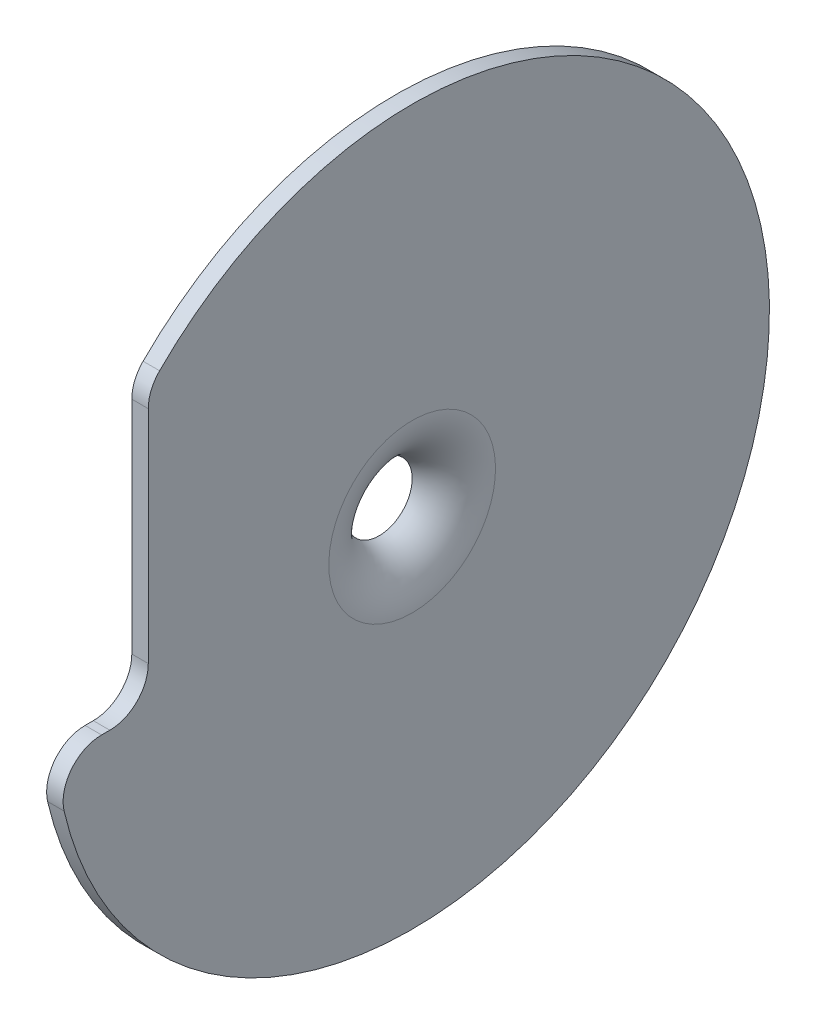
from build123d import *

# Parameters (mm, degrees)
SKETCH1_W           = 52
SKETCH1_H           = 38
BULK_EXTRUDE_DEPTH  = 3
FILLET1_R           = 7
SKETCH2_R           = 31.5
MOTOR_SUPPORT_DEPTH = 3
SKETCH3_R           = 6
WIRE_PASSTHRU_DEPTH = 143.168954603
FILLET2_R           = 10


with BuildPart() as part:
    # Sketch1 → BULK EXTRUDE (new body)
    # profile 1 of 3: a face of its own
    with BuildSketch(Plane.ZY.offset(19)):
        with BuildLine():
            Line((-2, -62.201941274), (-2, -24.5))
            Line((-2, -24.5), (-2, 25.456486729))
            ThreePointArc((-2, 25.456486729), (-115, -18.372727273), (-2, -62.201941274))
        make_face()
        with Locations((-57, 0)):
            Rectangle(SKETCH1_W, SKETCH1_H, mode=Mode.SUBTRACT)
    # profile 2 of 3: a face of its own
    with BuildSketch(Plane.ZY.offset(19)):
        with Locations((-57, 0)):
            Rectangle(SKETCH1_W, SKETCH1_H)
    # profile 3 of 3: a face of its own
    with BuildSketch(Plane.ZY.offset(19)):
        with BuildLine():
            Line((14.71055964, -24.5), (-2, -24.5))
            Line((-2, -24.5), (-2, -62.201941274))
            ThreePointArc((-2, -62.201941274), (9.424545918, -44.711355605), (14.71055964, -24.5))
        make_face()
    extrude(amount=BULK_EXTRUDE_DEPTH)

    # Fillet1
    fillet1_edges = [part.edges().sort_by_distance(p)[0] for p in [
        (-20.5, -24.5, -2),
        (-20.5, -24.5, 14.71055964),
        (-20.5, 25.456486729, -2),
    ]]
    fillet(fillet1_edges, radius=FILLET1_R)

    # Sketch2 → MOTOR SUPPORT (add)
    with BuildSketch(Plane.ZY.offset(22)):
        with Locations(Location((-50, -18.372727273, 0), (0, 0, 270))):
            Circle(SKETCH2_R)
    extrude(amount=MOTOR_SUPPORT_DEPTH)

    # Sketch3 → WIRE PASSTHRU (cut, through all)
    with BuildSketch(Plane.ZY.offset(25)):
        with Locations(Location((-50, -18.372727273, 0), (0, 0, 270))):
            Circle(SKETCH3_R)
    extrude(amount=-WIRE_PASSTHRU_DEPTH, mode=Mode.SUBTRACT)

    # Fillet2
    # the kernel refuses this fillet: 10 mm, written as the material it takes off along each edge
    with BuildSketch(Plane(origin=(-19, -18.372727273, -50), x_dir=(0, -1, 0), z_dir=(0, 0, -1))) as fillet2_piece_1:
        with BuildLine():
            CenterArc((15.16515139, 10), FILLET2_R, 203.578178478, 66.421821522)
            Line((6, 6), (5.816696972, 5.92))
            ThreePointArc((5.816696972, 5.92), (5.8, 3), (5.8, 0))
            Line((5.8, 0), (6, -0.2))
            Line((6, -0.2), (15.16515139, -0.2))
            Line((15.16515139, -0.2), (15.16515139, 0))
        make_face()
    revolve(axis=Axis((-19, -18.372727273, -50), (-1, 0, 0)), mode=Mode.SUBTRACT)


solid = part.part
